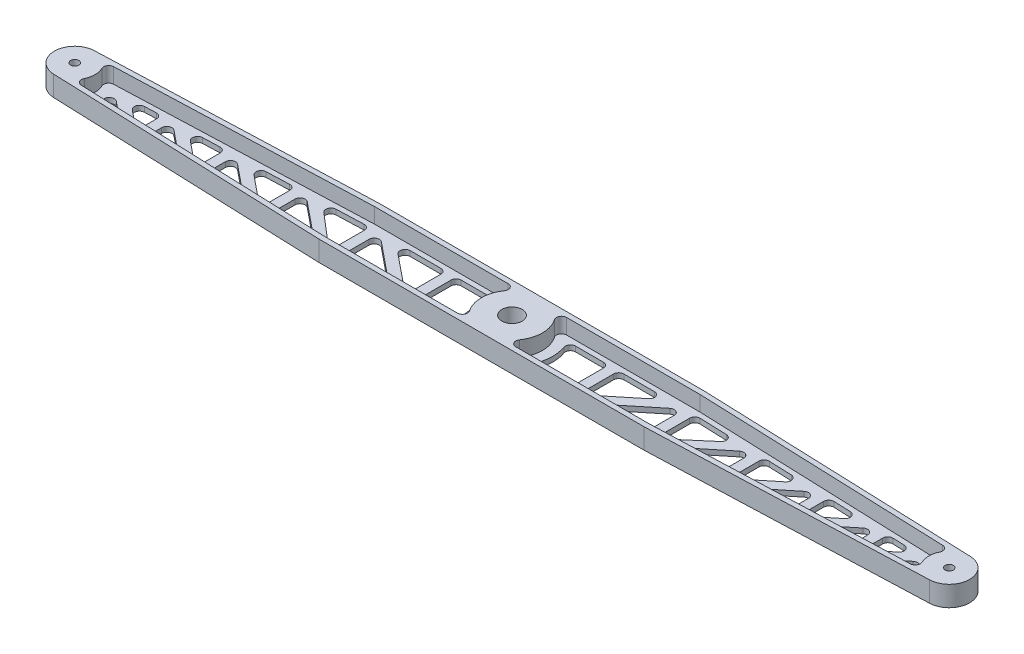
from build123d import *

# Parameters (mm, degrees)
SKETCH1_W            = 38.1
SKETCH1_H            = 12.7
BOSS_EXTRUDE1_DEPTH  = 292.1
SKETCH2_R            = 6.35
PIVOT_HOLE_DEPTH     = 293.995908675
END_HOLES_D          = 5.1054
CUT_EXTRUDE3_REACH   = 294.996
CUT_EXTRUDE4_DEPTH   = 9.525
CUT_EXTRUDE5_REACH   = 288.543
FILLET3_R            = 3.175
FILLET3_OF_MIRROR1_R = 3.175
FILLET4_R            = 3.175


with BuildPart() as part:
    # Sketch1 → Boss-Extrude1 (new, symmetric)
    with BuildSketch(Plane(origin=(0, 0, 0), x_dir=(0, 0, -1), z_dir=(1, 0, 0))):
        Rectangle(SKETCH1_W, SKETCH1_H)
    extrude(amount=BOSS_EXTRUDE1_DEPTH, both=True)

    # Sketch2 → Pivot Hole (cut, through all)
    with BuildSketch(Plane(origin=(0, 6.35, 0), x_dir=(1, 0, 0), z_dir=(0, 1, 0))):
        Circle(SKETCH2_R)
    extrude(amount=-PIVOT_HOLE_DEPTH, mode=Mode.SUBTRACT)

    # End Holes (through all)
    with Locations(Plane(origin=(0, -6.35, 0), x_dir=(-1, 0, 0), z_dir=(0, -1, 0))):
        with Locations((273.05, 0), (-273.05, 0)):
            Hole(END_HOLES_D / 2)

    # Sketch7 → Cut-Extrude3 (cut, up to next)
    with BuildSketch(Plane(origin=(0, 6.35, 0), x_dir=(1, 0, 0), z_dir=(0, 1, 0)), mode=Mode.PRIVATE) as cut_extrude3_sk1:
        with BuildLine():
            Line((292.1, 19.05), (101.6, 19.05))
            Line((101.6, 19.05), (273.519406165, 12.691322148))
            ThreePointArc((273.519406165, 12.691322148), (285.75, 0), (273.519406165, -12.691322148))
            Line((273.519406165, -12.691322148), (101.6, -19.05))
            Line((101.6, -19.05), (292.1, -19.05))
            Line((292.1, -19.05), (292.1, 19.05))
        make_face()
    cut_extrude3_tool1 = extrude(cut_extrude3_sk1.sketch, amount=-CUT_EXTRUDE3_REACH, mode=Mode.PRIVATE) & part.part
    # Sketch7 → Cut-Extrude3 (cut, up to next)
    with BuildSketch(Plane(origin=(0, 6.35, 0), x_dir=(1, 0, 0), z_dir=(0, 1, 0)), mode=Mode.PRIVATE) as cut_extrude3_sk2:
        with BuildLine():
            Line((-273.519406165, 12.691322148), (-101.6, 19.05))
            Line((-101.6, 19.05), (-292.1, 19.05))
            Line((-292.1, 19.05), (-292.1, -19.05))
            Line((-292.1, -19.05), (-101.6, -19.05))
            Line((-101.6, -19.05), (-273.519406165, -12.691322148))
            ThreePointArc((-273.519406165, -12.691322148), (-285.75, 0), (-273.519406165, 12.691322148))
        make_face()
    cut_extrude3_tool2 = extrude(cut_extrude3_sk2.sketch, amount=-CUT_EXTRUDE3_REACH, mode=Mode.PRIVATE) & part.part
    add(cut_extrude3_tool1.solids().sort_by_distance((196.85, 6.35, -17.107274))[0], mode=Mode.SUBTRACT)
    add(cut_extrude3_tool2.solids().sort_by_distance((-187.631508, 6.35, 17.81206))[0], mode=Mode.SUBTRACT)

    # Sketch9 → Cut-Extrude4 (cut)
    with BuildSketch(Plane(origin=(0, 6.35, 0), x_dir=(1, 0, 0), z_dir=(0, 1, 0))):
        with BuildLine():
            Line((-265.007534071, 9.828974604), (-101.6, 15.872829053))
            Line((-101.6, 15.872829053), (-10.533555802, 15.872829053))
            ThreePointArc((-10.533555802, 15.872829053), (-19.05, 0), (-10.533555802, -15.872829053))
            Line((-10.533555802, -15.872829053), (-101.6, -15.872829053))
            Line((-101.6, -15.872829053), (-265.007534071, -9.828974604))
            ThreePointArc((-265.007534071, -9.828974604), (-260.35, 0), (-265.007534071, 9.828974604))
        make_face()
        with BuildLine():
            Line((101.6, -15.872829053), (265.007534071, -9.828974604))
            ThreePointArc((265.007534071, -9.828974604), (260.35, 0), (265.007534071, 9.828974604))
            Line((265.007534071, 9.828974604), (101.6, 15.872829053))
            Line((101.6, 15.872829053), (10.533555802, 15.872829053))
            ThreePointArc((10.533555802, 15.872829053), (19.05, 0), (10.533555802, -15.872829053))
            Line((10.533555802, -15.872829053), (101.6, -15.872829053))
        make_face()
    extrude(amount=-CUT_EXTRUDE4_DEPTH, mode=Mode.SUBTRACT)

    # Sketch10 → Cut-Extrude5 (cut, up to next)
    with BuildSketch(Plane(origin=(0, -3.175, 0), x_dir=(1, 0, 0), z_dir=(0, 1, 0)), mode=Mode.PRIVATE) as cut_extrude5_sk1:
        Polygon((-130.055079824, 11.643207485), (-101.6, 12.695658107), (-101.6, -12.695658107), align=None)
    cut_extrude5_tool1 = extrude(cut_extrude5_sk1.sketch, amount=-CUT_EXTRUDE5_REACH, mode=Mode.PRIVATE) & part.part
    # Sketch10 → Cut-Extrude5 (cut, up to next)
    with BuildSketch(Plane(origin=(0, -3.175, 0), x_dir=(1, 0, 0), z_dir=(0, 1, 0)), mode=Mode.PRIVATE) as cut_extrude5_sk2:
        Polygon((-140.112148049, 11.271232858), (-111.055289307, -12.345941109), (-140.112148049, -11.271232858), align=None)
    cut_extrude5_tool2 = extrude(cut_extrude5_sk2.sketch, amount=-CUT_EXTRUDE5_REACH, mode=Mode.PRIVATE) & part.part
    # Sketch10 → Cut-Extrude5 (cut, up to next)
    with BuildSketch(Plane(origin=(0, -3.175, 0), x_dir=(1, 0, 0), z_dir=(0, 1, 0)), mode=Mode.PRIVATE) as cut_extrude5_sk3:
        Polygon((-95.25, 12.695658107), (-95.25, -12.695658107), (-64.010365252, -12.695658107), align=None)
    cut_extrude5_tool3 = extrude(cut_extrude5_sk3.sketch, amount=-CUT_EXTRUDE5_REACH, mode=Mode.PRIVATE) & part.part
    # Sketch10 → Cut-Extrude5 (cut, up to next)
    with BuildSketch(Plane(origin=(0, -3.175, 0), x_dir=(1, 0, 0), z_dir=(0, 1, 0)), mode=Mode.PRIVATE) as cut_extrude5_sk4:
        Polygon((-85.182284223, 12.695658107), (-53.942649475, -12.695658107), (-53.942649475, 12.695658107), align=None)
    cut_extrude5_tool4 = extrude(cut_extrude5_sk4.sketch, amount=-CUT_EXTRUDE5_REACH, mode=Mode.PRIVATE) & part.part
    # Sketch10 → Cut-Extrude5 (cut, up to next)
    with BuildSketch(Plane(origin=(0, -3.175, 0), x_dir=(1, 0, 0), z_dir=(0, 1, 0)), mode=Mode.PRIVATE) as cut_extrude5_sk5:
        with BuildLine():
            Line((-255.336463177, 7.009501638), (-237.266204005, -7.677855254))
            Line((-237.266204005, -7.677855254), (-255.336463177, -7.009501638))
            ThreePointArc((-255.336463177, -7.009501638), (-254, 0), (-255.336463177, 7.009501638))
        make_face()
    cut_extrude5_tool5 = extrude(cut_extrude5_sk5.sketch, amount=-CUT_EXTRUDE5_REACH, mode=Mode.PRIVATE) & part.part
    # Sketch10 → Cut-Extrude5 (cut, up to next)
    with BuildSketch(Plane(origin=(0, -3.175, 0), x_dir=(1, 0, 0), z_dir=(0, 1, 0)), mode=Mode.PRIVATE) as cut_extrude5_sk6:
        Polygon((-245.706942313, 7.365662832), (-226.718511576, -8.067976298), (-226.718511576, 8.067976298), align=None)
    cut_extrude5_tool6 = extrude(cut_extrude5_sk6.sketch, amount=-CUT_EXTRUDE5_REACH, mode=Mode.PRIVATE) & part.part
    # Sketch10 → Cut-Extrude5 (cut, up to next)
    with BuildSketch(Plane(origin=(0, -3.175, 0), x_dir=(1, 0, 0), z_dir=(0, 1, 0)), mode=Mode.PRIVATE) as cut_extrude5_sk7:
        Polygon((-220.368511576, 8.302839862), (-220.368511576, -8.302839862), (-198.964070017, -9.094512841), align=None)
    cut_extrude5_tool7 = extrude(cut_extrude5_sk7.sketch, amount=-CUT_EXTRUDE5_REACH, mode=Mode.PRIVATE) & part.part
    # Sketch10 → Cut-Extrude5 (cut, up to next)
    with BuildSketch(Plane(origin=(0, -3.175, 0), x_dir=(1, 0, 0), z_dir=(0, 1, 0)), mode=Mode.PRIVATE) as cut_extrude5_sk8:
        Polygon((-210.738990712, 8.659001056), (-188.416377588, -9.484633885), (-188.416377588, 9.484633885), align=None)
    cut_extrude5_tool8 = extrude(cut_extrude5_sk8.sketch, amount=-CUT_EXTRUDE5_REACH, mode=Mode.PRIVATE) & part.part
    # Sketch10 → Cut-Extrude5 (cut, up to next)
    with BuildSketch(Plane(origin=(0, -3.175, 0), x_dir=(1, 0, 0), z_dir=(0, 1, 0)), mode=Mode.PRIVATE) as cut_extrude5_sk9:
        Polygon((-182.066377588, 9.719497449), (-182.066377588, -9.719497449), (-157.009840477, -10.646248251), align=None)
    cut_extrude5_tool9 = extrude(cut_extrude5_sk9.sketch, amount=-CUT_EXTRUDE5_REACH, mode=Mode.PRIVATE) & part.part
    # Sketch10 → Cut-Extrude5 (cut, up to next)
    with BuildSketch(Plane(origin=(0, -3.175, 0), x_dir=(1, 0, 0), z_dir=(0, 1, 0)), mode=Mode.PRIVATE) as cut_extrude5_sk10:
        Polygon((-172.436856725, 10.075658643), (-146.462148049, -11.036369295), (-146.462148049, 11.036369295), align=None)
    cut_extrude5_tool10 = extrude(cut_extrude5_sk10.sketch, amount=-CUT_EXTRUDE5_REACH, mode=Mode.PRIVATE) & part.part
    # Sketch10 → Cut-Extrude5 (cut, up to next)
    with BuildSketch(Plane(origin=(0, -3.175, 0), x_dir=(1, 0, 0), z_dir=(0, 1, 0)), mode=Mode.PRIVATE) as cut_extrude5_sk11:
        with BuildLine():
            Line((-47.592649475, 12.695658107), (-47.592649475, -12.695658107))
            Line((-47.592649475, -12.695658107), (-21.999551478, -12.695658107))
            ThreePointArc((-21.999551478, -12.695658107), (-25.4, 0), (-21.999551478, 12.695658107))
            Line((-21.999551478, 12.695658107), (-47.592649475, 12.695658107))
        make_face()
    cut_extrude5_tool11 = extrude(cut_extrude5_sk11.sketch, amount=-CUT_EXTRUDE5_REACH, mode=Mode.PRIVATE) & part.part
    cut_extrude5_1 = cut_extrude5_tool1.solids().sort_by_distance((-111.085027, -3.175, -3.881069))[0]
    add(cut_extrude5_1, mode=Mode.SUBTRACT)
    cut_extrude5_2 = cut_extrude5_tool2.solids().sort_by_distance((-130.426528, -3.175, 4.115314))[0]
    add(cut_extrude5_2, mode=Mode.SUBTRACT)
    cut_extrude5_3 = cut_extrude5_tool3.solids().sort_by_distance((-84.836788, -3.175, 4.231886))[0]
    add(cut_extrude5_3, mode=Mode.SUBTRACT)
    cut_extrude5_4 = cut_extrude5_tool4.solids().sort_by_distance((-64.355861, -3.175, -4.231886))[0]
    add(cut_extrude5_4, mode=Mode.SUBTRACT)
    cut_extrude5_5 = cut_extrude5_tool5.solids().sort_by_distance((-248.70792, -3.175, 2.841521))[0]
    add(cut_extrude5_5, mode=Mode.SUBTRACT)
    cut_extrude5_6 = cut_extrude5_tool6.solids().sort_by_distance((-233.047988, -3.175, -2.455221))[0]
    add(cut_extrude5_6, mode=Mode.SUBTRACT)
    cut_extrude5_7 = cut_extrude5_tool7.solids().sort_by_distance((-213.233698, -3.175, 3.031504))[0]
    add(cut_extrude5_7, mode=Mode.SUBTRACT)
    cut_extrude5_8 = cut_extrude5_tool8.solids().sort_by_distance((-195.857249, -3.175, -2.886334))[0]
    add(cut_extrude5_8, mode=Mode.SUBTRACT)
    cut_extrude5_9 = cut_extrude5_tool9.solids().sort_by_distance((-173.714199, -3.175, 3.548749))[0]
    add(cut_extrude5_9, mode=Mode.SUBTRACT)
    cut_extrude5_10 = cut_extrude5_tool10.solids().sort_by_distance((-155.120384, -3.175, -3.358553))[0]
    add(cut_extrude5_10, mode=Mode.SUBTRACT)
    cut_extrude5_11 = cut_extrude5_tool11.solids().sort_by_distance((-35.924096, -3.175, 0))[0]
    add(cut_extrude5_11, mode=Mode.SUBTRACT)
    cut_extrude5 = cut_extrude5_1 + cut_extrude5_2 + cut_extrude5_3 + cut_extrude5_4 + cut_extrude5_5 + cut_extrude5_6 + cut_extrude5_7 + cut_extrude5_8 + cut_extrude5_9 + cut_extrude5_10 + cut_extrude5_11  # Cut-Extrude5 as one shape, for the pattern or mirror that repeats it

    # Fillet3
    fillet3_edges = [part.edges().sort_by_distance(p)[0] for p in [
        (-21.999551478, -4.7625, 12.695658107),
        (-21.999551478, -4.7625, -12.695658107),
        (-47.592649475, -4.7625, -12.695658107),
        (-47.592649475, -4.7625, 12.695658107),
        (-53.942649475, -4.7625, 12.695658107),
        (-53.942649475, -4.7625, -12.695658107),
        (-85.182284223, -4.7625, -12.695658107),
        (-64.010365252, -4.7625, 12.695658107),
        (-95.25, -4.7625, -12.695658107),
        (-95.25, -4.7625, 12.695658107),
        (-101.6, -4.7625, 12.695658107),
        (-130.055079824, -4.7625, -11.643207485),
        (-101.6, -4.7625, -12.695658107),
        (-111.055289307, -4.7625, 12.345941109),
        (-140.112148049, -4.7625, -11.271232858),
        (-140.112148049, -4.7625, 11.271232858),
        (-146.462148049, -4.7625, 11.036369295),
        (-146.462148049, -4.7625, -11.036369295),
        (-172.436856725, -4.7625, -10.075658643),
        (-157.009840477, -4.7625, 10.646248251),
        (-182.066377588, -4.7625, -9.719497449),
        (-182.066377588, -4.7625, 9.719497449),
        (-188.416377588, -4.7625, 9.484633885),
        (-188.416377588, -4.7625, -9.484633885),
        (-210.738990712, -4.7625, -8.659001056),
        (-198.964070017, -4.7625, 9.094512841),
        (-220.368511576, -4.7625, -8.302839862),
        (-220.368511576, -4.7625, 8.302839862),
        (-226.718511576, -4.7625, 8.067976298),
        (-226.718511576, -4.7625, -8.067976298),
        (-245.706942313, -4.7625, -7.365662832),
        (-237.266204005, -4.7625, 7.677855254),
        (-255.336463177, -4.7625, 7.009501638),
        (-255.336463177, -4.7625, -7.009501638),
    ]]
    fillet(fillet3_edges, radius=FILLET3_R)

    # Mirror1: Cut-Extrude5 across plane
    add(cut_extrude5.mirror(Plane(origin=(0, 0, 0), x_dir=(0, 0, 1), z_dir=(1, 0, 0))), mode=Mode.SUBTRACT)

    # Fillet3 of Mirror1
    fillet3_of_mirror1_edges = [part.edges().sort_by_distance(p)[0] for p in [
        (21.999551478, -4.7625, 12.695658107),
        (21.999551478, -4.7625, -12.695658107),
        (47.592649475, -4.7625, -12.695658107),
        (47.592649475, -4.7625, 12.695658107),
        (53.942649475, -4.7625, 12.695658107),
        (53.942649475, -4.7625, -12.695658107),
        (85.182284223, -4.7625, -12.695658107),
        (64.010365252, -4.7625, 12.695658107),
        (95.25, -4.7625, -12.695658107),
        (95.25, -4.7625, 12.695658107),
        (101.6, -4.7625, 12.695658107),
        (130.055079824, -4.7625, -11.643207485),
        (101.6, -4.7625, -12.695658107),
        (111.055289307, -4.7625, 12.345941109),
        (140.112148049, -4.7625, -11.271232858),
        (140.112148049, -4.7625, 11.271232858),
        (146.462148049, -4.7625, 11.036369295),
        (146.462148049, -4.7625, -11.036369295),
        (172.436856725, -4.7625, -10.075658643),
        (157.009840477, -4.7625, 10.646248251),
        (182.066377588, -4.7625, -9.719497449),
        (182.066377588, -4.7625, 9.719497449),
        (188.416377588, -4.7625, 9.484633885),
        (188.416377588, -4.7625, -9.484633885),
        (210.738990712, -4.7625, -8.659001056),
        (198.964070017, -4.7625, 9.094512841),
        (220.368511576, -4.7625, -8.302839862),
        (220.368511576, -4.7625, 8.302839862),
        (226.718511576, -4.7625, 8.067976298),
        (226.718511576, -4.7625, -8.067976298),
        (245.706942313, -4.7625, -7.365662832),
        (237.266204005, -4.7625, 7.677855254),
        (255.336463177, -4.7625, 7.009501638),
        (255.336463177, -4.7625, -7.009501638),
    ]]
    fillet(fillet3_of_mirror1_edges, radius=FILLET3_OF_MIRROR1_R)

    # Fillet4
    fillet4_edges = [part.edges().sort_by_distance(p)[0] for p in [
        (10.533555802, 1.5875, 15.872829053),
        (10.533555802, 1.5875, -15.872829053),
        (265.007534071, 1.5875, 9.828974604),
        (265.007534071, 1.5875, -9.828974604),
        (-265.007534071, 1.5875, 9.828974604),
        (-265.007534071, 1.5875, -9.828974604),
        (-10.533555802, 1.5875, 15.872829053),
        (-10.533555802, 1.5875, -15.872829053),
    ]]
    fillet(fillet4_edges, radius=FILLET4_R)


solid = part.part
